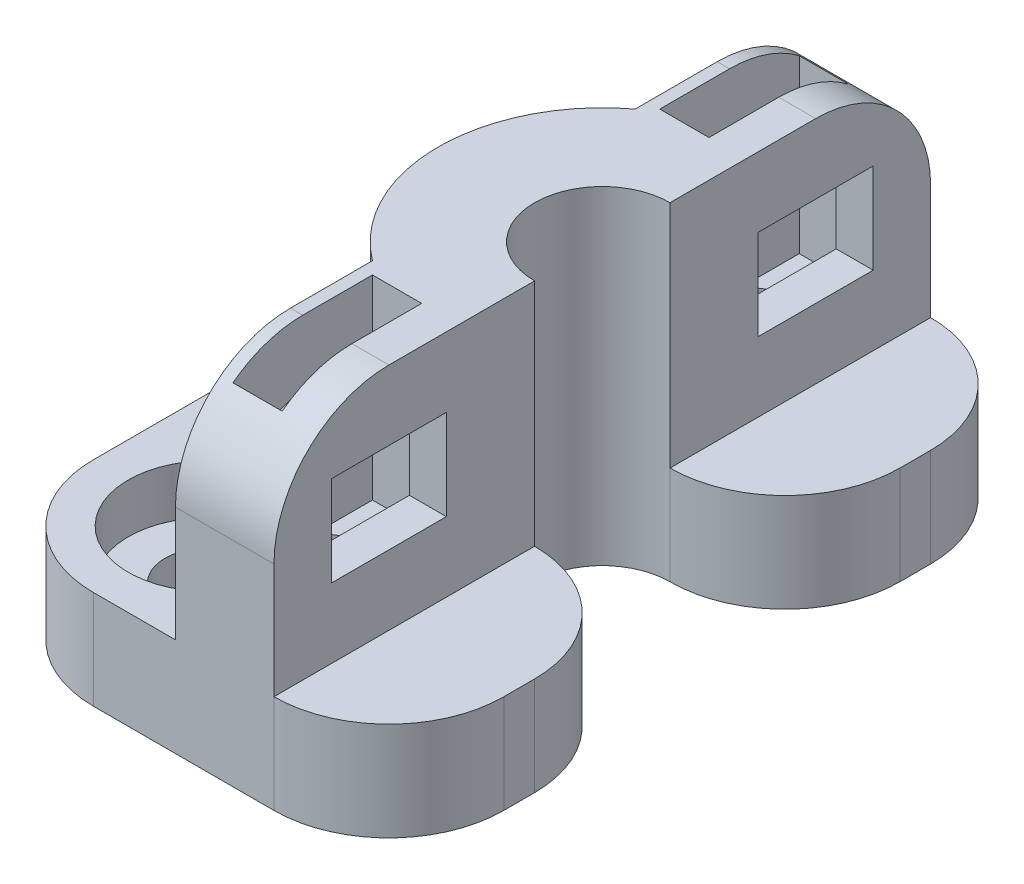
from build123d import *

# Parameters (mm, degrees)
SKETCH1_W                = 18
SKETCH1_H                = 40
BOSS_EXTRUDE1_DEPTH      = 6
BOSS_EXTRUDE2_DEPTH      = 14
SKETCH3_R                = 4.125
CUT_EXTRUDE1_DEPTH       = 30.681644159
FILLET1_R                = 7
SKETCH12_W               = 3
SKETCH12_H               = 8.5
CUT_EXTRUDE7_DEPTH       = 11.875
SKETCH13_R               = 1.5
CUT_EXTRUDE8_DEPTH       = 25.940241077
CUT_EXTRUDE9_REACH       = 32.725
SKETCH14_R               = 3
CUT_EXTRUDE10_REACH      = 35.526
SKETCH15_W               = 7
SKETCH15_H               = 5.5
SKETCH7_W                = 15.875
SKETCH7_H                = 6
BOSS_EXTRUDE3_DEPTH      = 7
FILLET2_R                = 7
SKETCH8_R                = 2.625
CUT_EXTRUDE4_DEPTH       = 30.189039039
BOSS_EXTRUDE4_DEPTH      = 2.5
BOSS_EXTRUDE4_DEPTH_BACK = 2.5
SKETCH10_R               = 4.875
CUT_EXTRUDE5_DEPTH       = 3


with BuildPart() as part:
    # Sketch1 → Boss-Extrude1 (new body)
    with BuildSketch(Plane(origin=(0, 0, 0), x_dir=(1, 0, 0), z_dir=(0, 1, 0))):
        Rectangle(SKETCH1_W, SKETCH1_H)
    extrude(amount=BOSS_EXTRUDE1_DEPTH)

    # Sketch2 → Boss-Extrude2 (add)
    with BuildSketch(Plane(origin=(0, 6, 0), x_dir=(1, 0, 0), z_dir=(0, 1, 0))):
        with BuildLine():
            Line((3, -20), (3, -8))
            ThreePointArc((3, -8), (-1, 0), (3, 8))
            Line((3, 8), (3, 20))
            Line((3, 20), (9, 20))
            Line((9, 20), (9, -20))
            Line((9, -20), (3, -20))
        make_face()
    extrude(amount=BOSS_EXTRUDE2_DEPTH)

    # Sketch3 → Cut-Extrude1 (cut, through all)
    with BuildSketch(Plane(origin=(0, 20, 0), x_dir=(1, 0, 0), z_dir=(0, 1, 0))):
        with Locations((9, 0)):
            Circle(SKETCH3_R)
    extrude(amount=-CUT_EXTRUDE1_DEPTH, mode=Mode.SUBTRACT)

    # Fillet1
    fillet1_edges = [part.edges().sort_by_distance(p)[0] for p in [
        (6, 20, 20),
        (6, 20, -20),
    ]]
    fillet(fillet1_edges, radius=FILLET1_R)

    # Sketch12 → Cut-Extrude7 (cut)
    with BuildSketch(Plane(origin=(0, 20, 0), x_dir=(1, 0, 0), z_dir=(0, 1, 0))):
        with Locations((5.25, 13)):
            Rectangle(SKETCH12_W, SKETCH12_H)
        with Locations((5.25, -13)):
            Rectangle(SKETCH12_W, SKETCH12_H)
    extrude(amount=-CUT_EXTRUDE7_DEPTH, mode=Mode.SUBTRACT)

    # Sketch13 → Cut-Extrude8 (cut, through all)
    with BuildSketch(Plane(origin=(0, 8.125, 0), x_dir=(1, 0, 0), z_dir=(0, 1, 0))):
        with Locations(Location((5.25, 13, 0), (0, 0, 270))):
            Circle(SKETCH13_R)
        with Locations((5.25, -13)):
            Circle(SKETCH13_R)
    extrude(amount=-CUT_EXTRUDE8_DEPTH, mode=Mode.SUBTRACT)

    # Sketch14 → Cut-Extrude9 (cut, up to next)
    with BuildSketch(Plane.ZY.offset(-3), mode=Mode.PRIVATE) as cut_extrude9_sk1:
        with Locations((-13, 13)):
            Circle(SKETCH14_R)
    cut_extrude9_tool1 = extrude(cut_extrude9_sk1.sketch, amount=-CUT_EXTRUDE9_REACH, mode=Mode.PRIVATE) & part.part
    # Sketch14 → Cut-Extrude9 (cut, up to next)
    with BuildSketch(Plane.ZY.offset(-3), mode=Mode.PRIVATE) as cut_extrude9_sk2:
        with Locations((13, 13)):
            Circle(SKETCH14_R)
    cut_extrude9_tool2 = extrude(cut_extrude9_sk2.sketch, amount=-CUT_EXTRUDE9_REACH, mode=Mode.PRIVATE) & part.part
    add(cut_extrude9_tool1.solids().sort_by_distance((3, 13, -13))[0], mode=Mode.SUBTRACT)
    add(cut_extrude9_tool2.solids().sort_by_distance((3, 13, 13))[0], mode=Mode.SUBTRACT)

    # Sketch15 → Cut-Extrude10 (cut, up to next)
    with BuildSketch(Plane(origin=(9, 0, 0), x_dir=(0, 0, -1), z_dir=(1, 0, 0)), mode=Mode.PRIVATE) as cut_extrude10_sk1:
        with Locations((13, 13)):
            Rectangle(SKETCH15_W, SKETCH15_H)
    cut_extrude10_tool1 = extrude(cut_extrude10_sk1.sketch, amount=-CUT_EXTRUDE10_REACH, mode=Mode.PRIVATE) & part.part
    # Sketch15 → Cut-Extrude10 (cut, up to next)
    with BuildSketch(Plane(origin=(9, 0, 0), x_dir=(0, 0, -1), z_dir=(1, 0, 0)), mode=Mode.PRIVATE) as cut_extrude10_sk2:
        with Locations((-13, 13)):
            Rectangle(SKETCH15_W, SKETCH15_H)
    cut_extrude10_tool2 = extrude(cut_extrude10_sk2.sketch, amount=-CUT_EXTRUDE10_REACH, mode=Mode.PRIVATE) & part.part
    add(cut_extrude10_tool1.solids().sort_by_distance((9, 13, -13))[0], mode=Mode.SUBTRACT)
    add(cut_extrude10_tool2.solids().sort_by_distance((9, 13, 13))[0], mode=Mode.SUBTRACT)

    # Sketch7 → Boss-Extrude3 (add)
    with BuildSketch(Plane(origin=(9, 0, 0), x_dir=(0, 0, -1), z_dir=(1, 0, 0))):
        with Locations((-12.0625, 3)):
            Rectangle(SKETCH7_W, SKETCH7_H)
        with Locations((12.0625, 3)):
            Rectangle(SKETCH7_W, SKETCH7_H)
    extrude(amount=BOSS_EXTRUDE3_DEPTH)

    # Fillet2
    fillet2_edges = [part.edges().sort_by_distance(p)[0] for p in [
        (-9, 3, -20),
        (16, 3, -20),
        (16, 3, 20),
        (-9, 3, 20),
        (16, 3, -4.125),
        (16, 3, 4.125),
    ]]
    fillet(fillet2_edges, radius=FILLET2_R - 0.0001)  # a hair under: the kernel refuses the full size

    # Sketch8 → Cut-Extrude4 (cut, through all)
    with BuildSketch(Plane(origin=(0, 6, 0), x_dir=(1, 0, 0), z_dir=(0, 1, 0))):
        with Locations(Location((-2, 13, 0), (0, 0, 270))):
            Circle(SKETCH8_R)
        with Locations(Location((-2, -13, 0), (0, 0, 90))):
            Circle(SKETCH8_R)
    extrude(amount=-CUT_EXTRUDE4_DEPTH, mode=Mode.SUBTRACT)

    # Sketch9 → Boss-Extrude4 (add, two sides: drawn at the far end of the back side and taken through both)
    with BuildSketch(Plane.XY.offset(-BOSS_EXTRUDE4_DEPTH_BACK)):
        Polygon((-9, 6), (2, 17), (2, 6), align=None)
    extrude(amount=BOSS_EXTRUDE4_DEPTH + BOSS_EXTRUDE4_DEPTH_BACK)

    # Sketch10 → Cut-Extrude5 (cut)
    with BuildSketch(Plane(origin=(0, 6, 0), x_dir=(1, 0, 0), z_dir=(0, 1, 0))):
        with Locations(Location((-2, 13, 0), (0, 0, 270))):
            Circle(SKETCH10_R)
        with Locations(Location((-2, -13, 0), (0, 0, 90))):
            Circle(SKETCH10_R)
    extrude(amount=-CUT_EXTRUDE5_DEPTH, mode=Mode.SUBTRACT)


solid = part.part
